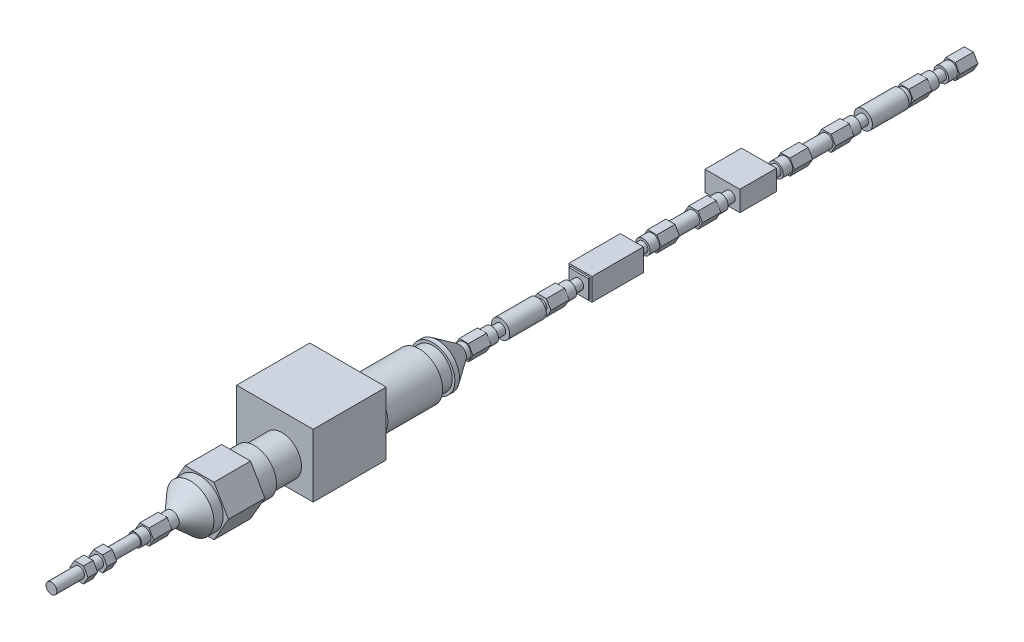
from build123d import *

# Parameters (mm, degrees)
BOSS_EXTRUDE1_DEPTH  = 6.3
SKETCH2_R            = 2.5
BOSS_EXTRUDE2_DEPTH  = 3.2
SKETCH3_R            = 1.75
BOSS_EXTRUDE3_DEPTH  = 3.2
SKETCH4_R            = 2.5
BOSS_EXTRUDE4_DEPTH  = 3.2
BOSS_EXTRUDE5_DEPTH  = 6.3
SKETCH6_R            = 2.5
BOSS_EXTRUDE6_DEPTH  = 1.6
SKETCH7_R            = 2.5
BOSS_EXTRUDE7_DEPTH  = 12.6
SKETCH8_R            = 1.75
BOSS_EXTRUDE8_DEPTH  = 3.2
SKETCH9_R            = 2.5
BOSS_EXTRUDE9_DEPTH  = 3.2
BOSS_EXTRUDE10_DEPTH = 6.3
SKETCH11_R           = 2.246
BOSS_EXTRUDE11_DEPTH = 7.9
BOSS_EXTRUDE12_DEPTH = 6.3
SKETCH13_R           = 2.5
BOSS_EXTRUDE13_DEPTH = 3.2
SKETCH14_R           = 1.75
BOSS_EXTRUDE14_DEPTH = 3.2
SKETCH15_W           = 6.663993084
SKETCH15_H           = 6.45350084
SKETCH15_R           = 1.75
BOSS_EXTRUDE15_DEPTH = 12.6
SKETCH16_R           = 1.75
BOSS_EXTRUDE16_DEPTH = 3.2
SKETCH17_R           = 2.5
BOSS_EXTRUDE17_DEPTH = 3.2
BOSS_EXTRUDE18_DEPTH = 6.3
SKETCH19_R           = 2.246
BOSS_EXTRUDE19_DEPTH = 7.9
BOSS_EXTRUDE20_DEPTH = 6.3
SKETCH21_R           = 2.5
BOSS_EXTRUDE21_DEPTH = 3.2
SKETCH22_R           = 1.75
BOSS_EXTRUDE22_DEPTH = 3.2
SKETCH23_W           = 6.663993084
SKETCH23_H           = 6.45350084
BOSS_EXTRUDE23_DEPTH = 0.63
SKETCH24_W           = 7.933993084
SKETCH24_H           = 7.72350084
BOSS_EXTRUDE24_DEPTH = 17.7
SKETCH25_W           = 6.663993084
SKETCH25_H           = 6.45350084
BOSS_EXTRUDE25_DEPTH = 0.63
SKETCH26_R           = 1.75
BOSS_EXTRUDE26_DEPTH = 3.2
SKETCH27_R           = 2.5
BOSS_EXTRUDE27_DEPTH = 3.2
BOSS_EXTRUDE28_DEPTH = 6.3
SKETCH29_R           = 1.75
BOSS_EXTRUDE29_DEPTH = 1.6
SKETCH30_R           = 3.15
BOSS_EXTRUDE30_DEPTH = 12.6
SKETCH31_R           = 1.75
BOSS_EXTRUDE31_DEPTH = 3.2
SKETCH32_R           = 2.5
BOSS_EXTRUDE32_DEPTH = 3.2
BOSS_EXTRUDE33_DEPTH = 6.3
SKETCH34_R           = 2.5
BOSS_EXTRUDE34_DEPTH = 1.6
SKETCH36_R           = 2.5
SKETCH35_R           = 7.62
SKETCH37_R           = 7.62
BOSS_EXTRUDE35_DEPTH = 1.6
SKETCH38_R           = 6.731
BOSS_EXTRUDE36_DEPTH = 4.7
SKETCH39_R           = 8.12
SKETCH39_R_2         = 7.62
SKETCH39_R_3         = 6.731
BOSS_EXTRUDE37_DEPTH = 18.9
SKETCH40_R           = 6.731
BOSS_EXTRUDE38_DEPTH = 3.2
SKETCH41_W           = 21.489539422
SKETCH41_H           = 17.349459624
SKETCH41_R           = 6.731
BOSS_EXTRUDE39_DEPTH = 25.2
SKETCH42_R           = 6.731
BOSS_EXTRUDE40_DEPTH = 9.5
SKETCH43_R           = 7.62
BOSS_EXTRUDE41_DEPTH = 6.3
BOSS_EXTRUDE42_DEPTH = 12.6
SKETCH45_R           = 8.128
BOSS_EXTRUDE43_DEPTH = 3.2
SKETCH48_R           = 2.5
BOSS_EXTRUDE44_DEPTH = 3.2
BOSS_EXTRUDE45_DEPTH = 6.3
SKETCH51_R           = 2.246
BOSS_EXTRUDE46_DEPTH = 3.2
SKETCH52_R           = 1.865
BOSS_EXTRUDE47_DEPTH = 9.5
BOSS_EXTRUDE48_DEPTH = 3.3
SKETCH54_R           = 1.865
BOSS_EXTRUDE49_DEPTH = 3.3
BOSS_EXTRUDE50_DEPTH = 3.3
SKETCH56_R           = 1.865
BOSS_EXTRUDE51_DEPTH = 9.5


with BuildPart() as part:
    # Sketch1 → Boss-Extrude1 (new body)
    with BuildSketch(Plane.XY):
        Polygon((3.15, 0), (1.575, 2.727980022), (-1.575, 2.727980022), (-3.15, 0), (-1.575, -2.727980022), (1.575, -2.727980022), align=None)
    extrude(amount=BOSS_EXTRUDE1_DEPTH)

    # Sketch2 → Boss-Extrude2 (add)
    with BuildSketch(Plane.XY.offset(6.3)):
        Circle(SKETCH2_R)
    extrude(amount=BOSS_EXTRUDE2_DEPTH)

    # Sketch3 → Boss-Extrude3 (add)
    with BuildSketch(Plane.XY.offset(9.5)):
        Circle(SKETCH3_R)
    extrude(amount=BOSS_EXTRUDE3_DEPTH)

    # Sketch4 → Boss-Extrude4 (add)
    with BuildSketch(Plane.XY.offset(12.7)):
        Circle(SKETCH4_R)
    extrude(amount=BOSS_EXTRUDE4_DEPTH)

    # Sketch5 → Boss-Extrude5 (add)
    with BuildSketch(Plane.XY.offset(15.9)):
        Polygon((1.575, -2.727980022), (3.15, 0), (1.575, 2.727980022), (-1.575, 2.727980022), (-3.15, 0), (-1.575, -2.727980022), align=None)
    extrude(amount=BOSS_EXTRUDE5_DEPTH)

    # Sketch6 → Boss-Extrude6 (add)
    with BuildSketch(Plane.XY.offset(22.2)):
        Circle(SKETCH6_R)
    extrude(amount=BOSS_EXTRUDE6_DEPTH)

    # Sketch7 → Boss-Extrude7 (add)
    # profile 1 of 8: a face of its own
    with BuildSketch(Plane.XY.offset(23.8)):
        Polygon((-1.575, 2.727980022), (-3.15, 0), (-1.575, -2.727980022), (1.575, -2.727980022), (3.15, 0), (1.575, 2.727980022), align=None)
        Circle(SKETCH7_R, mode=Mode.SUBTRACT)
    # profile 2 of 8: a face of its own
    with BuildSketch(Plane.XY.offset(23.8)):
        Circle(SKETCH7_R)
    # profile 3 of 8: a face of its own
    with BuildSketch(Plane.XY.offset(23.8)):
        with BuildLine():
            ThreePointArc((-1.575, 2.727980022), (-2.727980022, 1.575), (-3.15, 0))
            Line((-3.15, 0), (-1.575, 2.727980022))
        make_face()
    # profile 4 of 8: a face of its own
    with BuildSketch(Plane.XY.offset(23.8)):
        with BuildLine():
            ThreePointArc((1.575, 2.727980022), (0, 3.15), (-1.575, 2.727980022))
            Line((-1.575, 2.727980022), (1.575, 2.727980022))
        make_face()
    # profile 5 of 8: a face of its own
    with BuildSketch(Plane.XY.offset(23.8)):
        with BuildLine():
            Line((1.575, 2.727980022), (3.15, 0))
            ThreePointArc((3.15, 0), (2.727980022, 1.575), (1.575, 2.727980022))
        make_face()
    # profile 6 of 8: a face of its own
    with BuildSketch(Plane.XY.offset(23.8)):
        with BuildLine():
            Line((3.15, 0), (1.575, -2.727980022))
            ThreePointArc((1.575, -2.727980022), (2.727980022, -1.575), (3.15, 0))
        make_face()
    # profile 7 of 8: a face of its own
    with BuildSketch(Plane.XY.offset(23.8)):
        with BuildLine():
            Line((1.575, -2.727980022), (-1.575, -2.727980022))
            ThreePointArc((-1.575, -2.727980022), (0, -3.15), (1.575, -2.727980022))
        make_face()
    # profile 8 of 8: a face of its own
    with BuildSketch(Plane.XY.offset(23.8)):
        with BuildLine():
            ThreePointArc((-3.15, 0), (-2.727980022, -1.575), (-1.575, -2.727980022))
            Line((-1.575, -2.727980022), (-3.15, 0))
        make_face()
    extrude(amount=BOSS_EXTRUDE7_DEPTH)

    # Sketch8 → Boss-Extrude8 (add)
    with BuildSketch(Plane.XY.offset(36.4)):
        Circle(SKETCH8_R)
    extrude(amount=BOSS_EXTRUDE8_DEPTH)

    # Sketch9 → Boss-Extrude9 (add)
    with BuildSketch(Plane.XY.offset(39.6)):
        Circle(SKETCH9_R)
    extrude(amount=BOSS_EXTRUDE9_DEPTH)

    # Sketch10 → Boss-Extrude10 (add)
    with BuildSketch(Plane.XY.offset(42.8)):
        Polygon((-1.575, -2.727980022), (1.575, -2.727980022), (3.15, 0), (1.575, 2.727980022), (-1.575, 2.727980022), (-3.15, 0), align=None)
    extrude(amount=BOSS_EXTRUDE10_DEPTH)

    # Sketch11 → Boss-Extrude11 (add)
    with BuildSketch(Plane.XY.offset(49.1)):
        Circle(SKETCH11_R)
    extrude(amount=BOSS_EXTRUDE11_DEPTH)

    # Sketch12 → Boss-Extrude12 (add)
    with BuildSketch(Plane.XY.offset(57)):
        Polygon((-3.15, 0), (-1.575, -2.727980022), (1.575, -2.727980022), (3.15, 0), (1.575, 2.727980022), (-1.575, 2.727980022), align=None)
    extrude(amount=BOSS_EXTRUDE12_DEPTH)

    # Sketch13 → Boss-Extrude13 (add)
    with BuildSketch(Plane.XY.offset(63.3)):
        Circle(SKETCH13_R)
    extrude(amount=BOSS_EXTRUDE13_DEPTH)

    # Sketch14 → Boss-Extrude14 (add)
    with BuildSketch(Plane.XY.offset(66.5)):
        Circle(SKETCH14_R)
    extrude(amount=BOSS_EXTRUDE14_DEPTH)

    # Sketch15 → Boss-Extrude15 (add)
    # profile 1 of 3: a face of its own
    with BuildSketch(Plane.XY.offset(69.7)):
        Polygon((-3.331996542, -3.22675042), (-3.331996542, 3.22675042), (3.331996542, 3.22675042), (3.331996542, 3.77324958), (-8.668003458, 3.77324958), (-8.668003458, -3.22675042), align=None)
    # profile 2 of 3: a face of its own
    with BuildSketch(Plane.XY.offset(69.7)):
        Rectangle(SKETCH15_W, SKETCH15_H)
        Circle(SKETCH15_R, mode=Mode.SUBTRACT)
    # profile 3 of 3: a face of its own
    with BuildSketch(Plane.XY.offset(69.7)):
        Circle(SKETCH15_R)
    extrude(amount=BOSS_EXTRUDE15_DEPTH)

    # Sketch16 → Boss-Extrude16 (add)
    with BuildSketch(Plane.XY.offset(82.3)):
        Circle(SKETCH16_R)
    extrude(amount=BOSS_EXTRUDE16_DEPTH)

    # Sketch17 → Boss-Extrude17 (add)
    with BuildSketch(Plane.XY.offset(85.5)):
        Circle(SKETCH17_R)
    extrude(amount=BOSS_EXTRUDE17_DEPTH)

    # Sketch18 → Boss-Extrude18 (add)
    with BuildSketch(Plane.XY.offset(88.7)):
        Polygon((-3.15, 0), (-1.575, -2.727980022), (1.575, -2.727980022), (3.15, 0), (1.575, 2.727980022), (-1.575, 2.727980022), align=None)
    extrude(amount=BOSS_EXTRUDE18_DEPTH)

    # Sketch19 → Boss-Extrude19 (add)
    with BuildSketch(Plane.XY.offset(95)):
        Circle(SKETCH19_R)
    extrude(amount=BOSS_EXTRUDE19_DEPTH)

    # Sketch20 → Boss-Extrude20 (add)
    with BuildSketch(Plane.XY.offset(102.9)):
        Polygon((-1.575, 2.727980022), (-3.15, 0), (-1.575, -2.727980022), (1.575, -2.727980022), (3.15, 0), (1.575, 2.727980022), align=None)
    extrude(amount=BOSS_EXTRUDE20_DEPTH)

    # Sketch21 → Boss-Extrude21 (add)
    with BuildSketch(Plane.XY.offset(109.2)):
        Circle(SKETCH21_R)
    extrude(amount=BOSS_EXTRUDE21_DEPTH)

    # Sketch22 → Boss-Extrude22 (add)
    with BuildSketch(Plane.XY.offset(112.4)):
        Circle(SKETCH22_R)
    extrude(amount=BOSS_EXTRUDE22_DEPTH)

    # Sketch23 → Boss-Extrude23 (add)
    with BuildSketch(Plane.XY.offset(115.6)):
        Rectangle(SKETCH23_W, SKETCH23_H)
    extrude(amount=BOSS_EXTRUDE23_DEPTH)

    # Sketch24 → Boss-Extrude24 (add)
    with BuildSketch(Plane.XY.offset(116.23)):
        Rectangle(SKETCH24_W, SKETCH24_H)
    extrude(amount=BOSS_EXTRUDE24_DEPTH)

    # Sketch25 → Boss-Extrude25 (add)
    with BuildSketch(Plane.XY.offset(133.93)):
        Rectangle(SKETCH25_W, SKETCH25_H)
    extrude(amount=BOSS_EXTRUDE25_DEPTH)

    # Sketch26 → Boss-Extrude26 (add)
    with BuildSketch(Plane.XY.offset(134.56)):
        Circle(SKETCH26_R)
    extrude(amount=BOSS_EXTRUDE26_DEPTH)

    # Sketch27 → Boss-Extrude27 (add)
    with BuildSketch(Plane.XY.offset(137.76)):
        Circle(SKETCH27_R)
    extrude(amount=BOSS_EXTRUDE27_DEPTH)

    # Sketch28 → Boss-Extrude28 (add)
    with BuildSketch(Plane.XY.offset(140.96)):
        Polygon((-1.575, 2.727980022), (-3.15, 0), (-1.575, -2.727980022), (1.575, -2.727980022), (3.15, 0), (1.575, 2.727980022), align=None)
    extrude(amount=BOSS_EXTRUDE28_DEPTH)

    # Sketch29 → Boss-Extrude29 (add)
    with BuildSketch(Plane.XY.offset(147.26)):
        Circle(SKETCH29_R)
    extrude(amount=BOSS_EXTRUDE29_DEPTH)

    # Sketch30 → Boss-Extrude30 (add)
    with BuildSketch(Plane.XY.offset(148.86)):
        Circle(SKETCH30_R)
    extrude(amount=BOSS_EXTRUDE30_DEPTH)

    # Sketch31 → Boss-Extrude31 (add)
    with BuildSketch(Plane.XY.offset(161.46)):
        Circle(SKETCH31_R)
    extrude(amount=BOSS_EXTRUDE31_DEPTH)

    # Sketch32 → Boss-Extrude32 (add)
    with BuildSketch(Plane.XY.offset(164.66)):
        Circle(SKETCH32_R)
    extrude(amount=BOSS_EXTRUDE32_DEPTH)

    # Sketch33 → Boss-Extrude33 (add)
    with BuildSketch(Plane.XY.offset(167.86)):
        Polygon((1.575, 2.727980022), (-1.575, 2.727980022), (-3.15, 0), (-1.575, -2.727980022), (1.575, -2.727980022), (3.15, 0), align=None)
    extrude(amount=BOSS_EXTRUDE33_DEPTH)

    # Sketch34 → Boss-Extrude34 (add)
    with BuildSketch(Plane.XY.offset(174.16)):
        Circle(SKETCH34_R)
    extrude(amount=BOSS_EXTRUDE34_DEPTH)

    # Sketch36 → Loft2 section 0
    with BuildSketch(Plane.XY.offset(175.76)):
        Circle(SKETCH36_R)
    # Sketch35 → Loft2 section 1
    with BuildSketch(Plane.XY.offset(183.259999986)):
        Circle(SKETCH35_R)
    loft()

    # Sketch37 → Boss-Extrude35 (add)
    with BuildSketch(Plane.XY.offset(183.259999986)):
        Circle(SKETCH37_R)
    extrude(amount=BOSS_EXTRUDE35_DEPTH)

    # Sketch38 → Boss-Extrude36 (add)
    with BuildSketch(Plane.XY.offset(184.859999986)):
        with Locations(Location((0, 0, 0), (0, 0, 180))):
            Circle(SKETCH38_R)
    extrude(amount=BOSS_EXTRUDE36_DEPTH)

    # Sketch39 → Boss-Extrude37 (add)
    # profile 1 of 3: a face of its own
    with BuildSketch(Plane.XY.offset(189.559999986)):
        Circle(SKETCH39_R)
        Circle(SKETCH39_R_2, mode=Mode.SUBTRACT)
    # profile 2 of 3: a face of its own
    with BuildSketch(Plane.XY.offset(189.559999986)):
        Circle(SKETCH39_R_2)
        with Locations(Location((0, 0, 0), (0, 0, 180))):
            Circle(SKETCH39_R_3, mode=Mode.SUBTRACT)
    # profile 3 of 3: a face of its own
    with BuildSketch(Plane.XY.offset(189.559999986)):
        with Locations(Location((0, 0, 0), (0, 0, 180))):
            Circle(SKETCH39_R_3)
    extrude(amount=BOSS_EXTRUDE37_DEPTH)

    # Sketch40 → Boss-Extrude38 (add)
    with BuildSketch(Plane.XY.offset(208.459999986)):
        with Locations(Location((0, 0, 0), (0, 0, 180))):
            Circle(SKETCH40_R)
    extrude(amount=BOSS_EXTRUDE38_DEPTH)

    # Sketch41 → Boss-Extrude39 (add)
    # profile 1 of 3: a face of its own
    with BuildSketch(Plane.XY.offset(211.659999986)):
        Polygon((-10.744769711, -8.674729812), (-10.744769711, 8.674729812), (10.744769711, 8.674729812), (10.744769711, 13.087423692), (-15.603893932, 13.087423692), (-15.603893932, -8.674729812), align=None)
    # profile 2 of 3: a face of its own
    with BuildSketch(Plane.XY.offset(211.659999986)):
        Rectangle(SKETCH41_W, SKETCH41_H)
        with Locations(Location((0, 0, 0), (0, 0, 180))):
            Circle(SKETCH41_R, mode=Mode.SUBTRACT)
    # profile 3 of 3: a face of its own
    with BuildSketch(Plane.XY.offset(211.659999986)):
        with Locations(Location((0, 0, 0), (0, 0, 180))):
            Circle(SKETCH41_R)
    extrude(amount=BOSS_EXTRUDE39_DEPTH)

    # Sketch42 → Boss-Extrude40 (add)
    with BuildSketch(Plane.XY.offset(236.859999986)):
        with Locations(Location((0, 0, 0), (0, 0, 180))):
            Circle(SKETCH42_R)
    extrude(amount=BOSS_EXTRUDE40_DEPTH)

    # Sketch43 → Boss-Extrude41 (add)
    with BuildSketch(Plane.XY.offset(246.359999986)):
        Circle(SKETCH43_R)
    extrude(amount=BOSS_EXTRUDE41_DEPTH)

    # Sketch44 → Boss-Extrude42 (add)
    with BuildSketch(Plane.XY.offset(252.659999986)):
        Polygon((-9.9387352, 0), (-4.9693676, -8.607197164), (4.9693676, -8.607197164), (9.9387352, 0), (4.9693676, 8.607197164), (-4.9693676, 8.607197164), align=None)
    extrude(amount=BOSS_EXTRUDE42_DEPTH)

    # Sketch45 → Boss-Extrude43 (add)
    with BuildSketch(Plane.XY.offset(265.259999986)):
        Circle(SKETCH45_R)
    extrude(amount=BOSS_EXTRUDE43_DEPTH)

    # Loft3: read off the stored shape, not the designer's step
    # Loft3: loft between two sections, ruled curve by curve
    loft3_from = [
        Edge.make_bspline([(-1.595239547, 7.969918117, 268.459999986), (-17.535075781, 4.779439022, 268.459999986), (-14.344596686, -11.160397211, 268.459999986), (1.595239547, -7.969918117, 268.459999986), (17.535075781, -4.779439022, 268.459999986), (14.344596686, 11.160397211, 268.459999986), (-1.595239547, 7.969918117, 268.459999986)], [0, 0, 0, 0, 0.5, 0.5, 0.5, 1, 1, 1, 1], 3, [1, 0.333333333, 0.333333333, 1, 0.333333333, 0.333333333, 1]),
    ]
    loft3_to = [
        Edge.make_bspline([(-0.017278622, 2.499940289, 274.760000086), (-5.0171592, 2.465383045, 274.760000086), (-4.982601956, -2.534497533, 274.760000086), (0.017278622, -2.499940289, 274.760000086), (5.0171592, -2.465383045, 274.760000086), (4.982601956, 2.534497533, 274.760000086), (-0.017278622, 2.499940289, 274.760000086)], [0, 0, 0, 0, 0.5, 0.5, 0.5, 1, 1, 1, 1], 3, [1, 0.333333333, 0.333333333, 1, 0.333333333, 0.333333333, 1]),
    ]
    loft3 = Solid(Shell([*[Face.make_surface_from_curves(loft3_from[k], loft3_to[k]) for k in range(1)], Face(Wire(loft3_from)), Face(Wire(loft3_to))]))
    add(loft3)

    # Sketch48 → Boss-Extrude44 (add)
    with BuildSketch(Plane.XY.offset(274.760000086)):
        Circle(SKETCH48_R)
    extrude(amount=BOSS_EXTRUDE44_DEPTH)

    # Sketch50 → Boss-Extrude45 (add)
    with BuildSketch(Plane.XY.offset(277.960000086)):
        Polygon((1.575, 2.727980022), (-1.575, 2.727980022), (-3.15, 0), (-1.575, -2.727980022), (1.575, -2.727980022), (3.15, 0), align=None)
    extrude(amount=BOSS_EXTRUDE45_DEPTH)

    # Sketch51 → Boss-Extrude46 (add)
    with BuildSketch(Plane.XY.offset(284.260000086)):
        Circle(SKETCH51_R)
    extrude(amount=BOSS_EXTRUDE46_DEPTH)

    # Sketch52 → Boss-Extrude47 (add)
    with BuildSketch(Plane.XY.offset(287.460000086)):
        Circle(SKETCH52_R)
    extrude(amount=BOSS_EXTRUDE47_DEPTH)

    # Sketch53 → Boss-Extrude48 (add)
    with BuildSketch(Plane.XY.offset(296.960000086)):
        Polygon((3.15, 0), (1.575, 2.727980022), (-1.575, 2.727980022), (-3.15, 0), (-1.575, -2.727980022), (1.575, -2.727980022), align=None)
    extrude(amount=BOSS_EXTRUDE48_DEPTH)

    # Sketch54 → Boss-Extrude49 (add)
    with BuildSketch(Plane.XY.offset(300.260000086)):
        Circle(SKETCH54_R)
    extrude(amount=BOSS_EXTRUDE49_DEPTH)

    # Sketch55 → Boss-Extrude50 (add)
    with BuildSketch(Plane.XY.offset(303.560000086)):
        Polygon((1.575, -2.727980022), (3.15, 0), (1.575, 2.727980022), (-1.575, 2.727980022), (-3.15, 0), (-1.575, -2.727980022), align=None)
    extrude(amount=BOSS_EXTRUDE50_DEPTH)

    # Sketch56 → Boss-Extrude51 (add)
    with BuildSketch(Plane.XY.offset(306.860000086)):
        Circle(SKETCH56_R)
    extrude(amount=BOSS_EXTRUDE51_DEPTH)


solid = part.part
